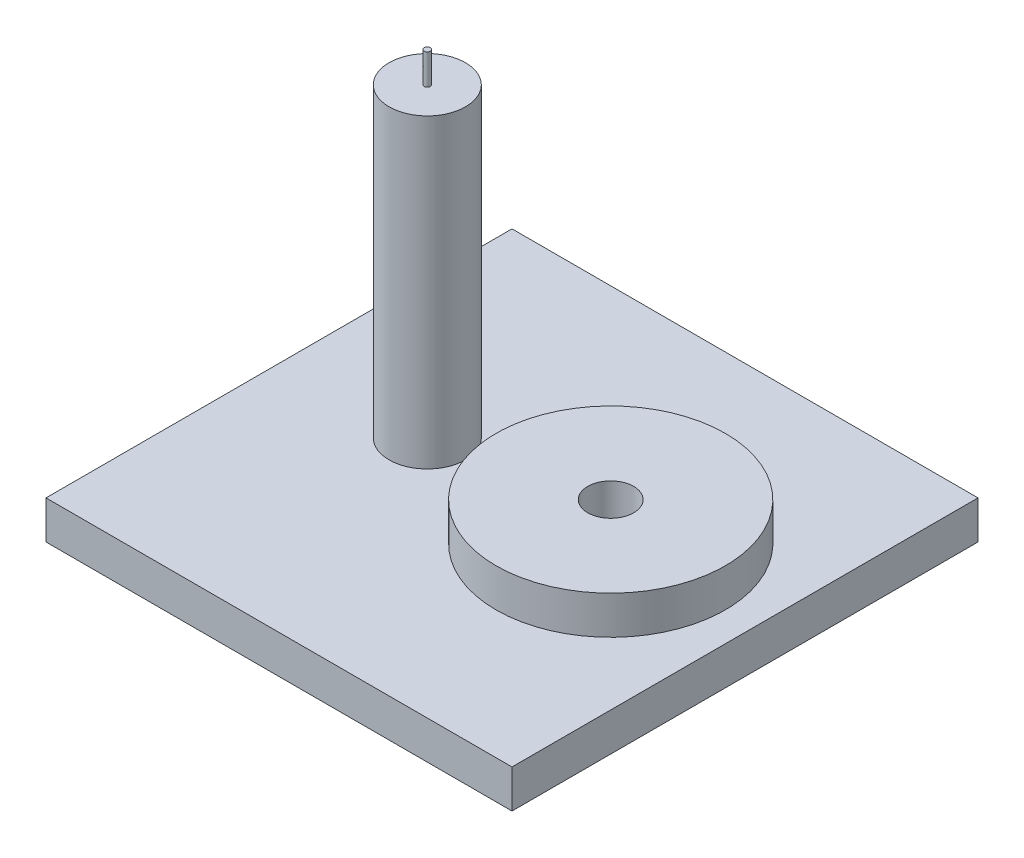
from build123d import *

# Parameters (mm, degrees)
SKETCH1_W           = 304.8
SKETCH1_H           = 304.8
BOSS_EXTRUDE1_DEPTH = 25
SKETCH2_R           = 75
BOSS_EXTRUDE2_DEPTH = 25
SKETCH3_R           = 15
CUT_EXTRUDE1_DEPTH  = 25
SKETCH4_R           = 25
BOSS_EXTRUDE3_DEPTH = 200
SKETCH5_R           = 2
BOSS_EXTRUDE4_DEPTH = 20


with BuildPart() as part:
    # Sketch1 → Boss-Extrude1 (new body)
    with BuildSketch(Plane(origin=(0, 0, 0), x_dir=(1, 0, 0), z_dir=(0, 1, 0))):
        with Locations((9.149880647, -6.318608089)):
            Rectangle(SKETCH1_W, SKETCH1_H)
    extrude(amount=BOSS_EXTRUDE1_DEPTH)

    # Sketch2 → Boss-Extrude2 (add)
    with BuildSketch(Plane(origin=(0, 25, 0), x_dir=(1, 0, 0), z_dir=(0, 1, 0))):
        with Locations((67.389364102, 0)):
            Circle(SKETCH2_R)
    extrude(amount=BOSS_EXTRUDE2_DEPTH)

    # Sketch3 → Cut-Extrude1 (cut)
    with BuildSketch(Plane(origin=(0, 50, 0), x_dir=(1, 0, 0), z_dir=(0, 1, 0))):
        with Locations((67.389364102, 0)):
            Circle(SKETCH3_R)
    extrude(amount=-CUT_EXTRUDE1_DEPTH, mode=Mode.SUBTRACT)

    # Sketch4 → Boss-Extrude3 (add)
    with BuildSketch(Plane(origin=(0, 25, 0), x_dir=(1, 0, 0), z_dir=(0, 1, 0))):
        with Locations((-52.57576907, 0)):
            Circle(SKETCH4_R)
    extrude(amount=BOSS_EXTRUDE3_DEPTH)

    # Sketch5 → Boss-Extrude4 (add)
    with BuildSketch(Plane(origin=(0, 225, 0), x_dir=(1, 0, 0), z_dir=(0, 1, 0))):
        with Locations((-52.57576907, 0)):
            Circle(SKETCH5_R)
    extrude(amount=BOSS_EXTRUDE4_DEPTH)


solid = part.part
